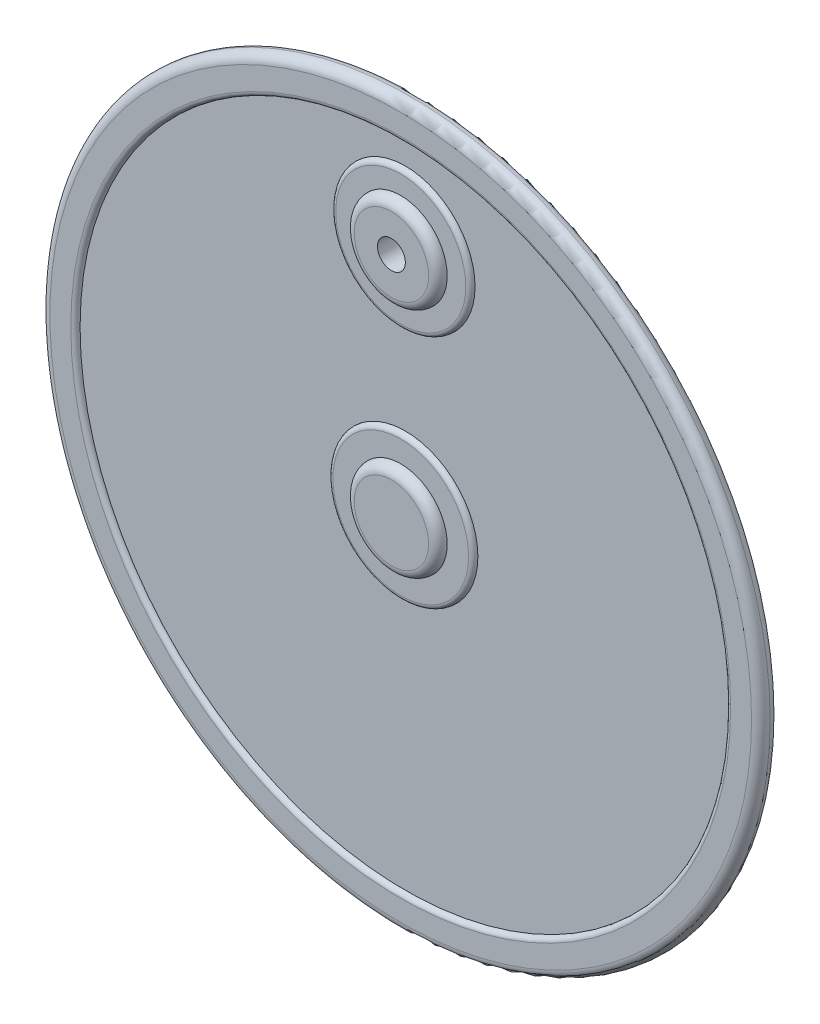
from build123d import *

# Parameters (mm, degrees)
SKETCH_3_R          = 77.5
EXTRUDE_1_DEPTH     = 4
FILLET_1_R          = 2
SKETCH_4_R          = 73.5
SKETCH_4_R_2        = 69.5
CUT_EXTRUDE_1_DEPTH = 2
FILLET_2_R          = 2
CUT_EXTRUDE_2_DEPTH = 2
SKETCH_7_R          = 10
EXTRUDE_2_DEPTH     = 2
SKETCH_8_R          = 6
EXTRUDE_3_DEPTH     = 10
EXTRUDE_START       = 2
SKETCH_9_R          = 10
EXTRUDE_4_DEPTH     = 2
SKETCH_10_R         = 3
CUT_EXTRUDE_3_DEPTH = 16
FILLET_3_R          = 2
FILLET_4_R          = 2
SKETCH_11_R         = 10
EXTRUDE_5_DEPTH     = 2
FILLET_5_R          = 2
SKETCH_12_R         = 70
SKETCH_12_R_2       = 15.606440373
SKETCH_12_R_3       = 15
CUT_EXTRUDE_4_DEPTH = 1
FILLET_6_R          = 1
SKETCH_13_R         = 15
CUT_EXTRUDE_5_DEPTH = 2
SKETCH_14_R         = 10
EXTRUDE_6_DEPTH     = 2
FILLET_7_R          = 2
SKETCH_15_R         = 4
EXTRUDE_7_DEPTH     = 7


with BuildPart() as part:
    # ｽｹｯﾁ3 → ﾎﾞｽ - 押し出し1 (new body)
    with BuildSketch(Plane.XY):
        Circle(SKETCH_3_R)
    extrude(amount=EXTRUDE_1_DEPTH)

    # ﾌｨﾚｯﾄ1
    fillet_1_edges = [part.edges().sort_by_distance(p)[0] for p in [
        (-77.5, 0, 0),
        (-77.5, 0, 4),
    ]]
    fillet(fillet_1_edges, radius=FILLET_1_R - 0.0001)  # a hair under: the kernel refuses the full size

    # ｽｹｯﾁ4 → ｶｯﾄ - 押し出し1 (cut)
    with BuildSketch(Plane(origin=(0, 0, 0), x_dir=(-1, 0, 0), z_dir=(0, 0, -1))):
        Circle(SKETCH_4_R)
        Circle(SKETCH_4_R_2, mode=Mode.SUBTRACT)
    extrude(amount=-CUT_EXTRUDE_1_DEPTH, mode=Mode.SUBTRACT)

    # ﾌｨﾚｯﾄ2
    fillet_2_edges = [part.edges().sort_by_distance(p)[0] for p in [
        (69.5, 0, 0),
    ]]
    fillet(fillet_2_edges, radius=FILLET_2_R - 0.0001)  # a hair under: the kernel refuses the full size

    # ｽｹｯﾁ6 → ｶｯﾄ - 押し出し2 (cut)
    with BuildSketch(Plane(origin=(0, 0, 0), x_dir=(-1, 0, 0), z_dir=(0, 0, -1))):
        with BuildLine():
            Line((13, 38), (-13, 38))
            ThreePointArc((-13, 38), (-25, 50), (-13, 62))
            Line((-13, 62), (13, 62))
            ThreePointArc((13, 62), (25, 50), (13, 38))
        make_face()
    extrude(amount=-CUT_EXTRUDE_2_DEPTH, mode=Mode.SUBTRACT)

    # ｽｹｯﾁ7 → ﾎﾞｽ - 押し出し2 (add)
    with BuildSketch(Plane(origin=(0, 0, 2), x_dir=(-1, 0, 0), z_dir=(0, 0, -1))):
        with Locations((0, 50)):
            Circle(SKETCH_7_R)
    extrude(amount=EXTRUDE_2_DEPTH)

    # ｽｹｯﾁ8 → ﾎﾞｽ - 押し出し3 (add)
    with BuildSketch(Plane(origin=(0, 0, 0), x_dir=(-1, 0, 0), z_dir=(0, 0, -1))):
        with Locations((0, 50)):
            Circle(SKETCH_8_R)
    extrude(amount=EXTRUDE_3_DEPTH)

    # ｽｹｯﾁ9 → ﾎﾞｽ - 押し出し4 (add)
    with BuildSketch(Plane.XY.offset(4).offset(EXTRUDE_START)):
        with Locations(Location((0, 50, 0), (0, 0, 180))):
            Circle(SKETCH_9_R)
    extrude(amount=-EXTRUDE_4_DEPTH)

    # ｽｹｯﾁ10 → ｶｯﾄ - 押し出し3 (cut)
    with BuildSketch(Plane(origin=(0, 0, -10), x_dir=(-1, 0, 0), z_dir=(0, 0, -1))):
        with Locations((0, 50)):
            Circle(SKETCH_10_R)
    extrude(amount=-CUT_EXTRUDE_3_DEPTH, mode=Mode.SUBTRACT)

    # ﾌｨﾚｯﾄ3
    fillet_3_edges = [part.edges().sort_by_distance(p)[0] for p in [
        (10, 50, 6),
    ]]
    fillet(fillet_3_edges, radius=FILLET_3_R - 0.0001)  # a hair under: the kernel refuses the full size

    # ﾌｨﾚｯﾄ4
    fillet_4_edges = [part.edges().sort_by_distance(p)[0] for p in [
        (-25, 50, 0),
        (0, 62, 0),
        (0, 38, 0),
        (25, 50, 0),
    ]]
    fillet(fillet_4_edges, radius=FILLET_4_R - 0.0001)  # a hair under: the kernel refuses the full size

    # ｽｹｯﾁ11 → ﾎﾞｽ - 押し出し5 (add)
    with BuildSketch(Plane.XY.offset(4)):
        Circle(SKETCH_11_R)
    extrude(amount=EXTRUDE_5_DEPTH)

    # ﾌｨﾚｯﾄ5
    fillet_5_edges = [part.edges().sort_by_distance(p)[0] for p in [
        (-10, 0, 6),
    ]]
    fillet(fillet_5_edges, radius=FILLET_5_R - 0.0001)  # a hair under: the kernel refuses the full size

    # ｽｹｯﾁ12 → ｶｯﾄ - 押し出し4 (cut)
    with BuildSketch(Plane.XY.offset(4)):
        Circle(SKETCH_12_R)
        Circle(SKETCH_12_R_2, mode=Mode.SUBTRACT)
        with Locations((0, 50)):
            Circle(SKETCH_12_R_3, mode=Mode.SUBTRACT)
    extrude(amount=-CUT_EXTRUDE_4_DEPTH, mode=Mode.SUBTRACT)

    # ﾌｨﾚｯﾄ6
    fillet_6_edges = [part.edges().sort_by_distance(p)[0] for p in [
        (-70, 0, 4),
        (-15.606440373, 0, 4),
        (-15, 50, 4),
    ]]
    fillet(fillet_6_edges, radius=FILLET_6_R - 0.0001)  # a hair under: the kernel refuses the full size

    # ｽｹｯﾁ13 → ｶｯﾄ - 押し出し5 (cut)
    with BuildSketch(Plane(origin=(0, 0, 0), x_dir=(-1, 0, 0), z_dir=(0, 0, -1))):
        Circle(SKETCH_13_R)
    extrude(amount=-CUT_EXTRUDE_5_DEPTH, mode=Mode.SUBTRACT)

    # ｽｹｯﾁ14 → ﾎﾞｽ - 押し出し6 (add)
    with BuildSketch(Plane(origin=(0, 0, 2), x_dir=(-1, 0, 0), z_dir=(0, 0, -1)).offset(EXTRUDE_START)):
        Circle(SKETCH_14_R)
    extrude(amount=-EXTRUDE_6_DEPTH)

    # ﾌｨﾚｯﾄ7
    fillet_7_edges = [part.edges().sort_by_distance(p)[0] for p in [
        (15, 0, 0),
    ]]
    fillet(fillet_7_edges, radius=FILLET_7_R - 0.0001)  # a hair under: the kernel refuses the full size

    # ｽｹｯﾁ15 → ﾎﾞｽ - 押し出し7 (add)
    with BuildSketch(Plane(origin=(0, 0, 0), x_dir=(-1, 0, 0), z_dir=(0, 0, -1))):
        Circle(SKETCH_15_R)
    extrude(amount=EXTRUDE_7_DEPTH)


solid = part.part
